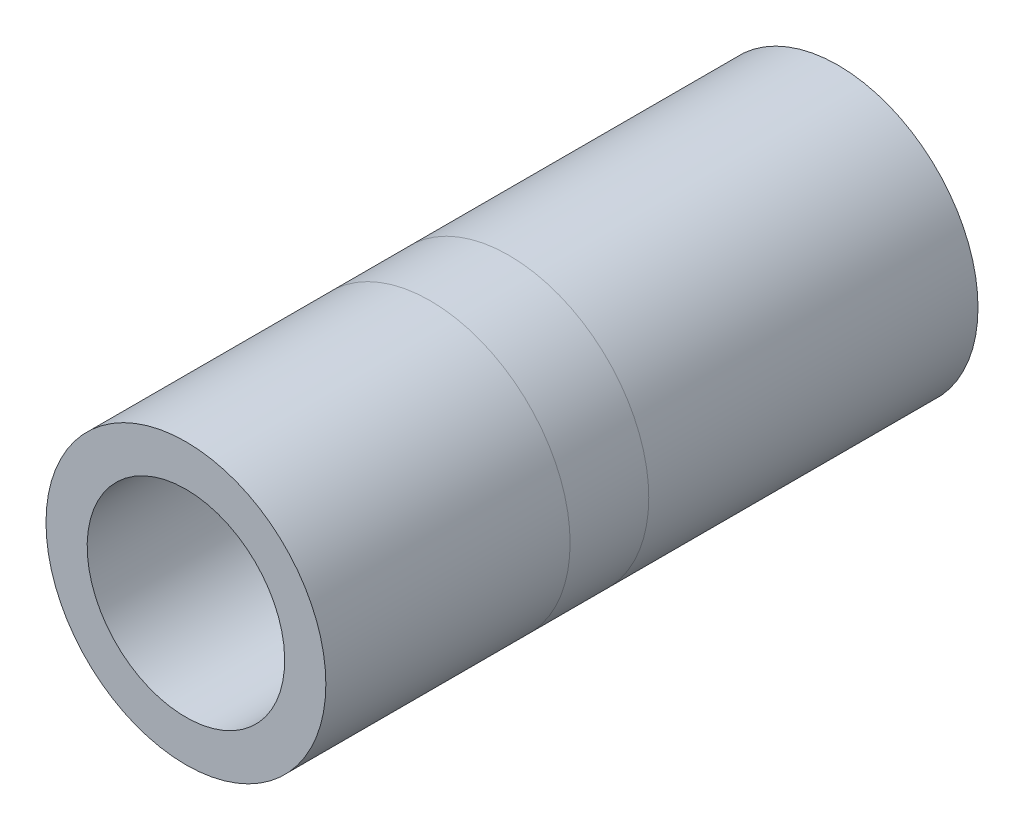
from build123d import *

# Parameters (mm, degrees)
SWEEP1_PROFILE_R     = 13.49375
CUT_SWEEP1_START     = -31.75
CUT_SWEEP1_OUTLINE_R = 9.525
CUT_SWEEP1_DEPTH     = 62.893389273


# Read off the part's stored shape, not the designer's step: Cut-Sweep1
with BuildPart() as part:
    # Sweep1: sweep along a curve in space
    with BuildLine() as sweep1_path:
        Line((0, 0, 0), (0, 0, -31.75))
        Line((0, 0, 0), (0, 0, 7.585389273))
        Line((0, 0, 7.585389273), (0, 0, 31.143389273))
    # Sweep1 profile (on start of the path) → Sweep1 (sweep)
    with BuildSketch(Plane(origin=(0, 0, 31.143389273), x_dir=(0, -1, 0), z_dir=(0, 0, -1))):
        Circle(SWEEP1_PROFILE_R)
    sweep(path=sweep1_path.line)

    # Cut-Sweep1 outline → Cut-Sweep1 (cut)
    with BuildSketch(Plane.XY.offset(CUT_SWEEP1_START)):
        Circle(CUT_SWEEP1_OUTLINE_R)
    extrude(amount=CUT_SWEEP1_DEPTH, mode=Mode.SUBTRACT)


solid = part.part
